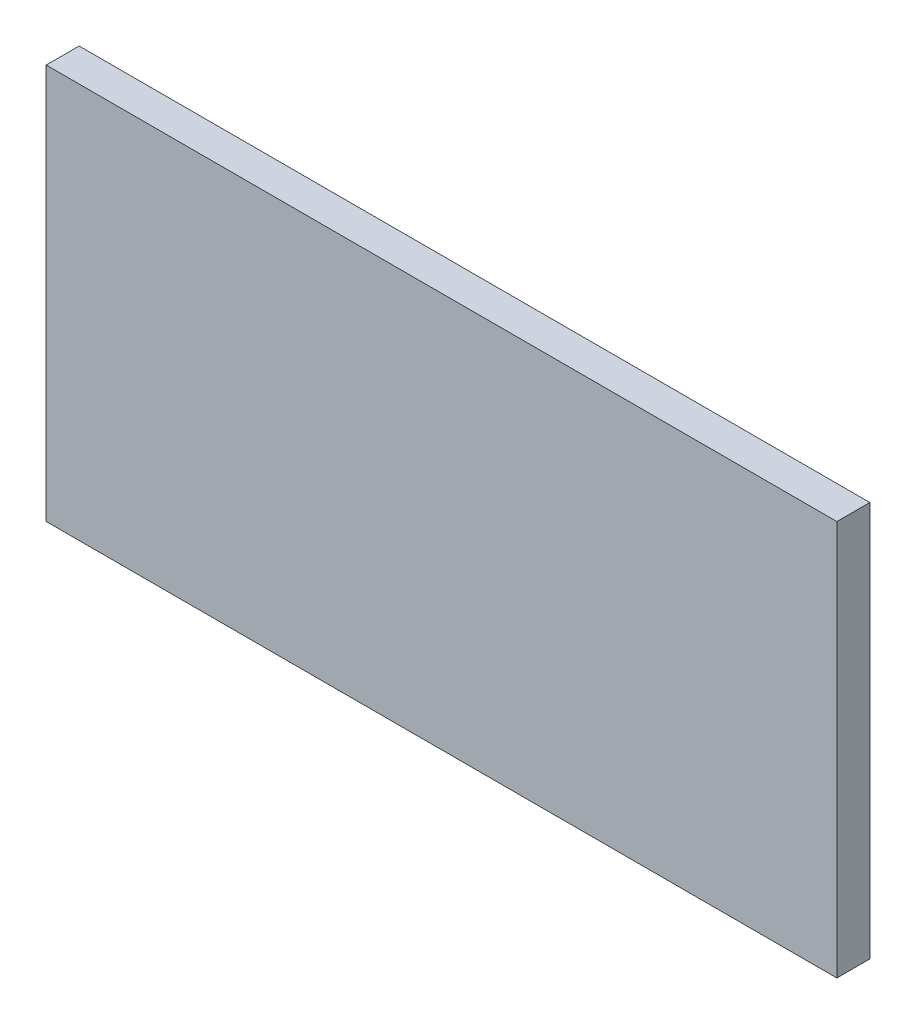
from build123d import *

# Parameters (mm, degrees)
SKETCH1_W           = 304.8
SKETCH1_H           = 152.4
BOSS_EXTRUDE1_DEPTH = 12.7


with BuildPart() as part:
    # Sketch1 → Boss-Extrude1 (new body)
    with BuildSketch(Plane.XY):
        with Locations((152.4, -76.2)):
            Rectangle(SKETCH1_W, SKETCH1_H)
    extrude(amount=BOSS_EXTRUDE1_DEPTH)


solid = part.part
